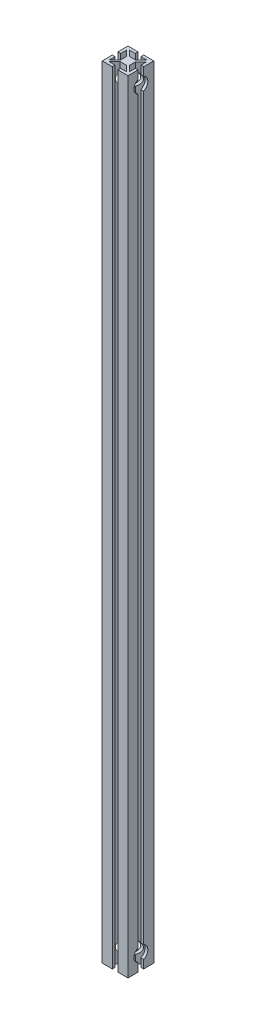
from build123d import *

# Parameters (mm, degrees)
EXTRUDE1_DEPTH          = 1155.7
SKETCH2_R               = 10.3124
EXTRUDE2_DEPTH          = 16.51
MIRROR2_COPY_1_SKETCH_R = 10.3124
MIRROR2_COPY_1_DEPTH    = 16.51


# Read off the part's stored shape, not the designer's step: 1515<1>
with BuildPart() as part:
    # Sketch1<2> → Extrude1 (new body)
    with BuildSketch(Plane(origin=(0, 0, 0), x_dir=(1, 0, 0), z_dir=(0, 1, 0))):
        Polygon((-6.7564, 4.364749804), (-6.7564, -4.364749804), (-14.986, -12.594349804), (-14.986, -4.064), (-19.05, -4.064), (-19.05, -19.05), (-4.064, -19.05), (-4.064, -14.986), (-13.067127258, -14.986), (-4.837527258, -6.7564), (4.837527258, -6.7564), (13.067127258, -14.986), (4.064, -14.986), (4.064, -19.05), (19.05, -19.05), (19.05, -4.064), (14.986, -4.064), (14.986, -12.594349804), (6.7564, -4.364749804), (6.7564, 4.364749804), (14.986, 12.594349804), (14.986, 4.064), (19.05, 4.064), (19.05, 19.05), (4.064, 19.05), (4.064, 14.986), (13.067127258, 14.986), (4.837527258, 6.7564), (-4.837527258, 6.7564), (-13.067127258, 14.986), (-4.064, 14.986), (-4.064, 19.05), (-19.05, 19.05), (-19.05, 4.064), (-14.986, 4.064), (-14.986, 12.594349804), align=None)
    extrude(amount=EXTRUDE1_DEPTH)

    # Sketch2 → Extrude2 (cut)
    with BuildSketch(Plane.ZY.offset(19.05)):
        with Locations(Location((0, 1133.983, 0), (0, 0, 310.932724574))):
            Circle(SKETCH2_R)
    extrude2 = extrude(amount=-EXTRUDE2_DEPTH, mode=Mode.SUBTRACT)

    # Mirror1: Extrude2 across plane
    add(extrude2.mirror(Plane(origin=(0, 0, 0), x_dir=(0, 0, 1), z_dir=(1, 0, 0))), mode=Mode.SUBTRACT)

    # Mirror2: Extrude2 across plane
    add(extrude2.mirror(Plane(origin=(0, 577.85, 0), x_dir=(0, 0, 1), z_dir=(0, -1, 0))), mode=Mode.SUBTRACT)

    # Mirror2 copy 1 sketch → Mirror2 copy 1 (cut)
    with BuildSketch(Plane(origin=(19.05, 1155.7, 0), x_dir=(0, 0, 1), z_dir=(1, 0, 0))):
        with Locations(Location((0, 1133.983, 0), (0, 0, 310.932724574))):
            Circle(MIRROR2_COPY_1_SKETCH_R)
    extrude(amount=-MIRROR2_COPY_1_DEPTH, mode=Mode.SUBTRACT)


solid = part.part
